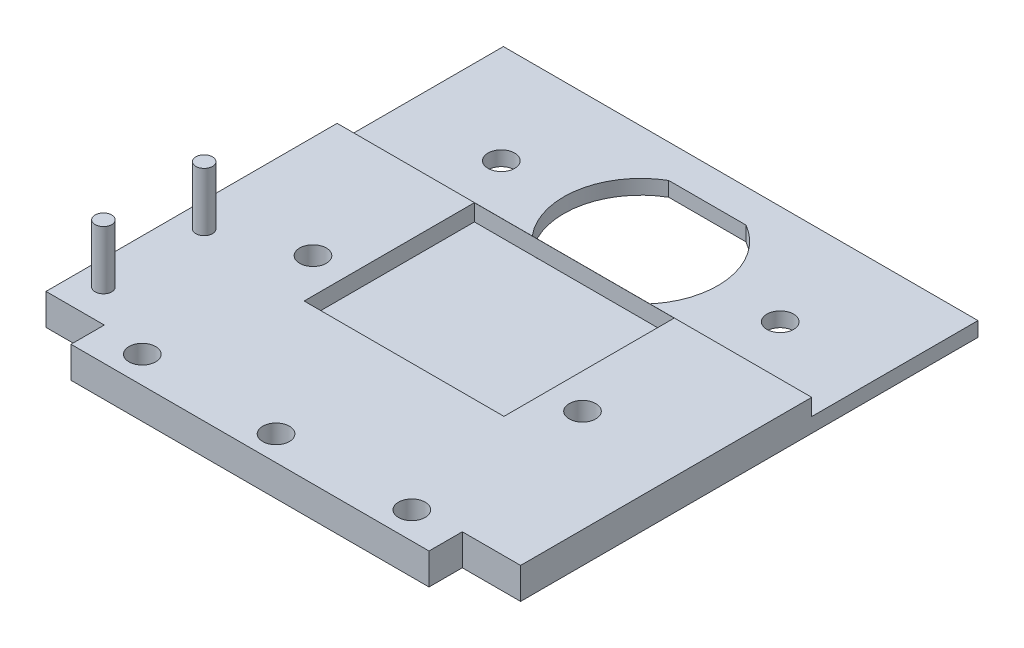
from build123d import *

# Parameters (mm, degrees)
AUFSATZ_LINEAR_AUSTRAGEN1_DEPTH = 3.75
SKIZZE16_W                      = 57
SKIZZE16_H                      = 19.970174162
SCHNITT_LINEAR_AUSTRAGEN6_DEPTH = 2
SCHNITT_LINEAR_AUSTRAGEN1_DEPTH = 2
SKIZZE10_R                      = 1.6
SCHNITT_LINEAR_AUSTRAGEN3_DEPTH = 3.2
SKIZZE17_R                      = 1.6
SCHNITT_LINEAR_AUSTRAGEN7_DEPTH = 4
SKIZZE18_W                      = 24
SKIZZE18_H                      = 20.451513558
SCHNITT_LINEAR_AUSTRAGEN8_DEPTH = 2
SKIZZE19_R                      = 1.6
SCHNITT_LINEAR_AUSTRAGEN9_DEPTH = 10
SKIZZE21_R                      = 1
AUFSATZ_LINEAR_AUSTRAGEN2_DEPTH = 7


with BuildPart() as part:
    # Skizze1 → Aufsatz-Linear austragen1 (new body)
    with BuildSketch(Plane(origin=(0, 0, 0), x_dir=(1, 0, 0), z_dir=(0, 1, 0))):
        Polygon((0, 4), (7, 4), (7, 0), (17.778730529, 0), (38.778730529, 0), (50, 0), (50, 4), (57, 4), (57, 58.933855223), (0, 58.933855223), align=None)
    extrude(amount=-AUFSATZ_LINEAR_AUSTRAGEN1_DEPTH)

    # Skizze16 → Schnitt-Linear austragen6 (cut)
    with BuildSketch(Plane(origin=(0, 0, 0), x_dir=(1, 0, 0), z_dir=(0, 1, 0))):
        with Locations((28.5, 48.948768142)):
            Rectangle(SKIZZE16_W, SKIZZE16_H)
    extrude(amount=-SCHNITT_LINEAR_AUSTRAGEN6_DEPTH, mode=Mode.SUBTRACT)

    # Skizze3 → Schnitt-Linear austragen1 (cut)
    with BuildSketch(Plane(origin=(0, -2, 0), x_dir=(1, 0, 0), z_dir=(0, 1, 0))):
        with BuildLine():
            Line((33.565408487, 39.194078943), (23.856456095, 38.933855223))
            ThreePointArc((23.856456095, 38.933855223), (19.25, 46.933855223), (23.856456095, 54.933855223))
            Line((23.856456095, 54.933855223), (33.143543905, 54.933855223))
            ThreePointArc((33.143543905, 54.933855223), (37.746679321, 47.181688892), (33.565408487, 39.194078943))
        make_face()
    extrude(amount=-SCHNITT_LINEAR_AUSTRAGEN1_DEPTH, mode=Mode.SUBTRACT)

    # Skizze10 → Schnitt-Linear austragen3 (cut)
    with BuildSketch(Plane(origin=(0, -2, 0), x_dir=(1, 0, 0), z_dir=(0, 1, 0))):
        with Locations((45.25, 46.933855223)):
            Circle(SKIZZE10_R)
        with Locations((11.75, 46.933855223)):
            Circle(SKIZZE10_R)
    extrude(amount=-SCHNITT_LINEAR_AUSTRAGEN3_DEPTH, mode=Mode.SUBTRACT)

    # Skizze17 → Schnitt-Linear austragen7 (cut)
    with BuildSketch(Plane(origin=(0, 0, 0), x_dir=(1, 0, 0), z_dir=(0, 1, 0))):
        with Locations((44.684736485, 3.25)):
            Circle(SKIZZE17_R)
        with Locations((44.684736485, 23.75)):
            Circle(SKIZZE17_R)
        with Locations((12.315263515, 3.25)):
            Circle(SKIZZE17_R)
        with Locations((12.315263515, 23.75)):
            Circle(SKIZZE17_R)
    extrude(amount=-SCHNITT_LINEAR_AUSTRAGEN7_DEPTH, mode=Mode.SUBTRACT)

    # Skizze18 → Schnitt-Linear austragen8 (cut)
    with BuildSketch(Plane(origin=(0, 0, 0), x_dir=(1, 0, 0), z_dir=(0, 1, 0))):
        with Locations((28.5, 28.725756779)):
            Rectangle(SKIZZE18_W, SKIZZE18_H)
    extrude(amount=-SCHNITT_LINEAR_AUSTRAGEN8_DEPTH, mode=Mode.SUBTRACT)

    # Skizze19 → Schnitt-Linear austragen9 (cut)
    with BuildSketch(Plane(origin=(0, 0, 0), x_dir=(1, 0, 0), z_dir=(0, 1, 0))):
        with Locations((28.632488743, 2.995468967)):
            Circle(SKIZZE19_R)
    extrude(amount=-SCHNITT_LINEAR_AUSTRAGEN9_DEPTH, mode=Mode.SUBTRACT)

    # Skizze21 → Aufsatz-Linear austragen2 (add)
    with BuildSketch(Plane(origin=(0, 0, 0), x_dir=(1, 0, 0), z_dir=(0, 1, 0))):
        with Locations((3, 20)):
            Circle(SKIZZE21_R)
        with Locations((3, 7.9)):
            Circle(SKIZZE21_R)
    extrude(amount=AUFSATZ_LINEAR_AUSTRAGEN2_DEPTH)


solid = part.part
